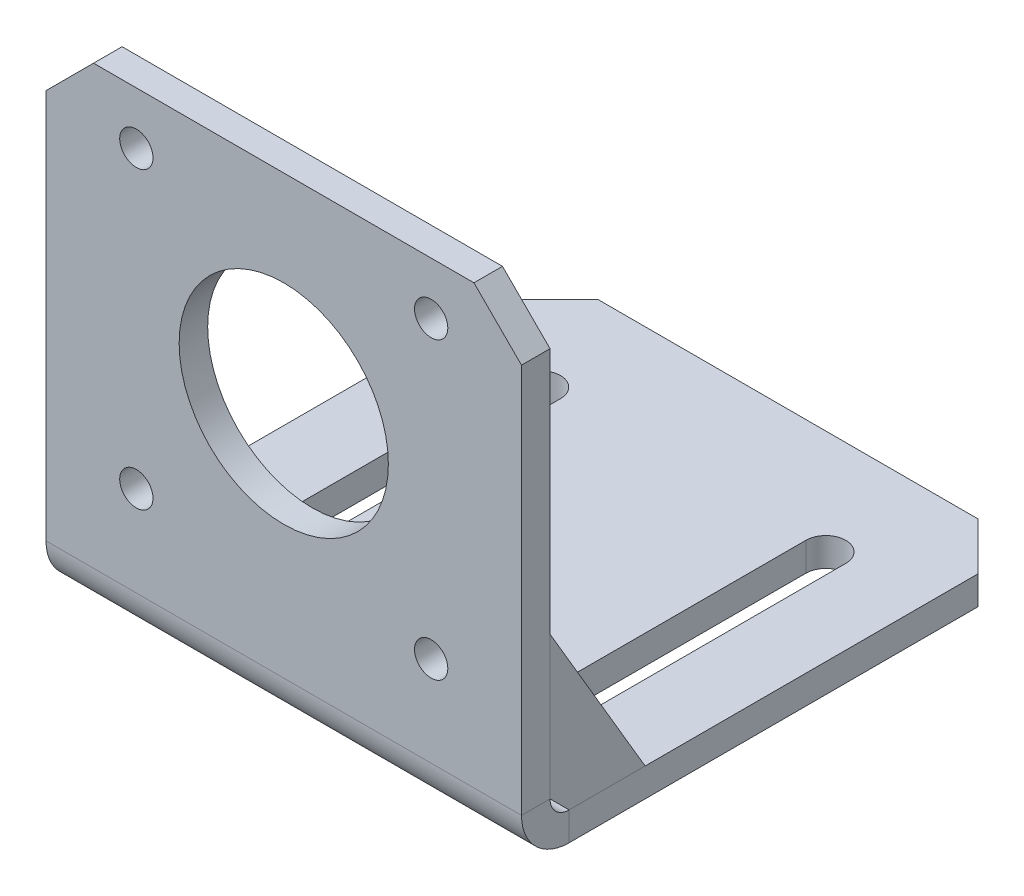
from build123d import *

# Parameters (mm, degrees)
BOSS_EXTRUDE2_DEPTH          = 50
SKETCH4_R                    = 11
SKETCH4_R_2                  = 1.75
CUT_EXTRUDE1_DEPTH           = 50
CHAMFER1_SIZE                = 5
CUT_EXTRUDE2_DEPTH           = 50
FLATTEN_BENDS1_START         = 3
FLATTEN_BENDS1_OUTLINE_W     = 50
FLATTEN_BENDS1_OUTLINE_H     = 3
FLATTEN_BENDS1_DEPTH         = 48
FLATTEN_BENDS1_2_OUTLINE_R   = 1.75
FLATTEN_BENDS1_2_OUTLINE_R_2 = 11
FLATTEN_BENDS1_2_DEPTH       = 3
PROCESS_BENDS1_START         = -0.067055507
PROCESS_BENDS1_OUTLINE_W     = 50
PROCESS_BENDS1_OUTLINE_H     = 3
PROCESS_BENDS1_DEPTH         = 46.564842651
PROCESS_BENDS1_START_2       = -3
PROCESS_BENDS1_2_OUTLINE_R   = 1.75
PROCESS_BENDS1_2_OUTLINE_R_2 = 11
PROCESS_BENDS1_2_DEPTH       = 2.5137
PROCESS_BENDS1_START_3       = -5
PROCESS_BENDS1_3_OUTLINE_R   = 1.75
PROCESS_BENDS1_3_OUTLINE_R_2 = 11
PROCESS_BENDS1_3_DEPTH       = 5
PROCESS_BENDS1_4_DEPTH       = 50
BOSS_EXTRUDE3_DEPTH          = 3
BOSS_EXTRUDE4_START          = -50
BOSS_EXTRUDE4_DEPTH          = 3


with BuildPart() as part:
    # Sketch3 → Boss-Extrude2 (new body)
    with BuildSketch(Plane(origin=(0, 0, 0), x_dir=(0, 0, -1), z_dir=(1, 0, 0))):
        Polygon((0, 0), (0, 51), (3, 51), (3, 3), (53, 3), (53, 0), align=None)
    extrude(amount=BOSS_EXTRUDE2_DEPTH)

    # Sketch4 → Cut-Extrude1 (cut)
    with BuildSketch(Plane.XY):
        with Locations((25, 30)):
            Circle(SKETCH4_R)
        with Locations((9.5, 45.5)):
            Circle(SKETCH4_R_2)
        with Locations((40.5, 45.5)):
            Circle(SKETCH4_R_2)
        with Locations((40.5, 14.5)):
            Circle(SKETCH4_R_2)
        with Locations((9.5, 14.5)):
            Circle(SKETCH4_R_2)
    extrude(amount=-CUT_EXTRUDE1_DEPTH, mode=Mode.SUBTRACT)

    # Chamfer1
    chamfer1_edges = [part.edges().sort_by_distance(p)[0] for p in [
        (50, 51, -1.5),
        (0, 51, -1.5),
        (0, 1.5, -53),
        (50, 1.5, -53),
    ]]
    chamfer(chamfer1_edges, length=CHAMFER1_SIZE)

    # Sketch7 → Cut-Extrude2 (cut)
    with BuildSketch(Plane.XZ):
        with BuildLine():
            Line((7.9, -42), (7.9, -12))
            ThreePointArc((7.9, -12), (10, -9.9), (12.1, -12))
            Line((12.1, -12), (12.1, -42))
            ThreePointArc((12.1, -42), (10, -44.1), (7.9, -42))
        make_face()
        with BuildLine():
            Line((42.1, -42), (42.1, -12))
            ThreePointArc((42.1, -12), (40, -9.9), (37.9, -12))
            Line((37.9, -12), (37.9, -42))
            ThreePointArc((37.9, -42), (40, -44.1), (42.1, -42))
        make_face()
    extrude(amount=-CUT_EXTRUDE2_DEPTH, mode=Mode.SUBTRACT)

    # Flatten-Bends1: read off the stored shape, not the designer's step
    # Flatten-Bends1 outline → Flatten-Bends1 (cut)
    with BuildSketch(Plane(origin=(0, 0, 0), x_dir=(1, 0, 0), z_dir=(0, 1, 0)).offset(FLATTEN_BENDS1_START)):
        with Locations((25, 1.5)):
            Rectangle(FLATTEN_BENDS1_OUTLINE_W, FLATTEN_BENDS1_OUTLINE_H)
    extrude(amount=FLATTEN_BENDS1_DEPTH, mode=Mode.SUBTRACT)

    # Flatten-Bends1 2 outline → Flatten-Bends1 2 (add)
    with BuildSketch(Plane(origin=(0, 0, 0), x_dir=(1, 0, 0), z_dir=(0, 1, 0))):
        Polygon((0, 0), (0, -41.497787144), (5, -46.497787144), (45, -46.497787144), (50, -41.497787144), (50, 0), align=None)
        with Locations((9.5, -40.997787144)):
            Circle(FLATTEN_BENDS1_2_OUTLINE_R, mode=Mode.SUBTRACT)
        with Locations((40.5, -40.997787144)):
            Circle(FLATTEN_BENDS1_2_OUTLINE_R, mode=Mode.SUBTRACT)
        with Locations((25, -25.497787144)):
            Circle(FLATTEN_BENDS1_2_OUTLINE_R_2, mode=Mode.SUBTRACT)
        with Locations((9.5, -9.997787144)):
            Circle(FLATTEN_BENDS1_2_OUTLINE_R, mode=Mode.SUBTRACT)
        with Locations((40.5, -9.997787144)):
            Circle(FLATTEN_BENDS1_2_OUTLINE_R, mode=Mode.SUBTRACT)
    extrude(amount=FLATTEN_BENDS1_2_DEPTH)

    # Process-Bends1: read off the stored shape, not the designer's step
    # Process-Bends1 outline → Process-Bends1 (cut)
    with BuildSketch(Plane.XY.offset(PROCESS_BENDS1_START)):
        with Locations((25, 1.5)):
            Rectangle(PROCESS_BENDS1_OUTLINE_W, PROCESS_BENDS1_OUTLINE_H)
    extrude(amount=PROCESS_BENDS1_DEPTH, mode=Mode.SUBTRACT)

    # Process-Bends1 2 outline → Process-Bends1 2 (add)
    with BuildSketch(Plane.XY.offset(PROCESS_BENDS1_START_2)):
        Polygon((0, 46), (0, 3), (50, 3), (50, 46), (45, 51), (5, 51), align=None)
        with Locations((9.5, 14.5)):
            Circle(PROCESS_BENDS1_2_OUTLINE_R, mode=Mode.SUBTRACT)
        with Locations((40.5, 14.5)):
            Circle(PROCESS_BENDS1_2_OUTLINE_R, mode=Mode.SUBTRACT)
        with Locations((9.5, 45.5)):
            Circle(PROCESS_BENDS1_2_OUTLINE_R, mode=Mode.SUBTRACT)
        with Locations((25, 30)):
            Circle(PROCESS_BENDS1_2_OUTLINE_R_2, mode=Mode.SUBTRACT)
        with Locations((40.5, 45.5)):
            Circle(PROCESS_BENDS1_2_OUTLINE_R, mode=Mode.SUBTRACT)
    extrude(amount=PROCESS_BENDS1_2_DEPTH)

    # Process-Bends1 3 outline → Process-Bends1 3 (add)
    with BuildSketch(Plane.XY.offset(PROCESS_BENDS1_START_3)):
        Polygon((0, 46), (0, 3), (50, 3), (50, 46), (45, 51), (5, 51), align=None)
        with Locations((9.5, 14.5)):
            Circle(PROCESS_BENDS1_3_OUTLINE_R, mode=Mode.SUBTRACT)
        with Locations((40.5, 14.5)):
            Circle(PROCESS_BENDS1_3_OUTLINE_R, mode=Mode.SUBTRACT)
        with Locations((9.5, 45.5)):
            Circle(PROCESS_BENDS1_3_OUTLINE_R, mode=Mode.SUBTRACT)
        with Locations((25, 30)):
            Circle(PROCESS_BENDS1_3_OUTLINE_R_2, mode=Mode.SUBTRACT)
        with Locations((40.5, 45.5)):
            Circle(PROCESS_BENDS1_3_OUTLINE_R, mode=Mode.SUBTRACT)
    extrude(amount=PROCESS_BENDS1_3_DEPTH)

    # Process-Bends1 4 outline → Process-Bends1 4 (cut)
    with BuildSketch(Plane.YZ):
        with BuildLine():
            Line((51, -5), (51, -3))
            Line((51, -3), (5, -3))
            ThreePointArc((5, -3), (3.585786438, -3.585786438), (3, -5))
            Line((3, -5), (51, -5))
        make_face()
        with BuildLine():
            ThreePointArc((0, -5), (1.464466094, -1.464466094), (5, 0))
            Line((5, 0), (3, 0))
            Line((3, 0), (3, -0.067055507))
            Line((3, -0.067055507), (0, -0.067055507))
            Line((0, -0.067055507), (0, -5))
        make_face()
    extrude(amount=PROCESS_BENDS1_4_DEPTH, mode=Mode.SUBTRACT)


with BuildPart() as body_2:
    # Sketch14 → Boss-Extrude3 (new body)
    with BuildSketch(Plane(origin=(50, 0, 0), x_dir=(0, 0, -1), z_dir=(1, 0, 0))):
        Polygon((3, 20), (13, 3), (5, 3), (3, 5), align=None)
    extrude(amount=-BOSS_EXTRUDE3_DEPTH)


with BuildPart() as body_3:
    # Sketch14<2> → Boss-Extrude4 (new body)
    with BuildSketch(Plane(origin=(50, 0, 0), x_dir=(0, 0, -1), z_dir=(1, 0, 0)).offset(BOSS_EXTRUDE4_START)):
        Polygon((3, 20), (13, 3), (5, 3), (3, 5), align=None)
    extrude(amount=BOSS_EXTRUDE4_DEPTH)


solid = Compound([part.part, body_2.part, body_3.part])
